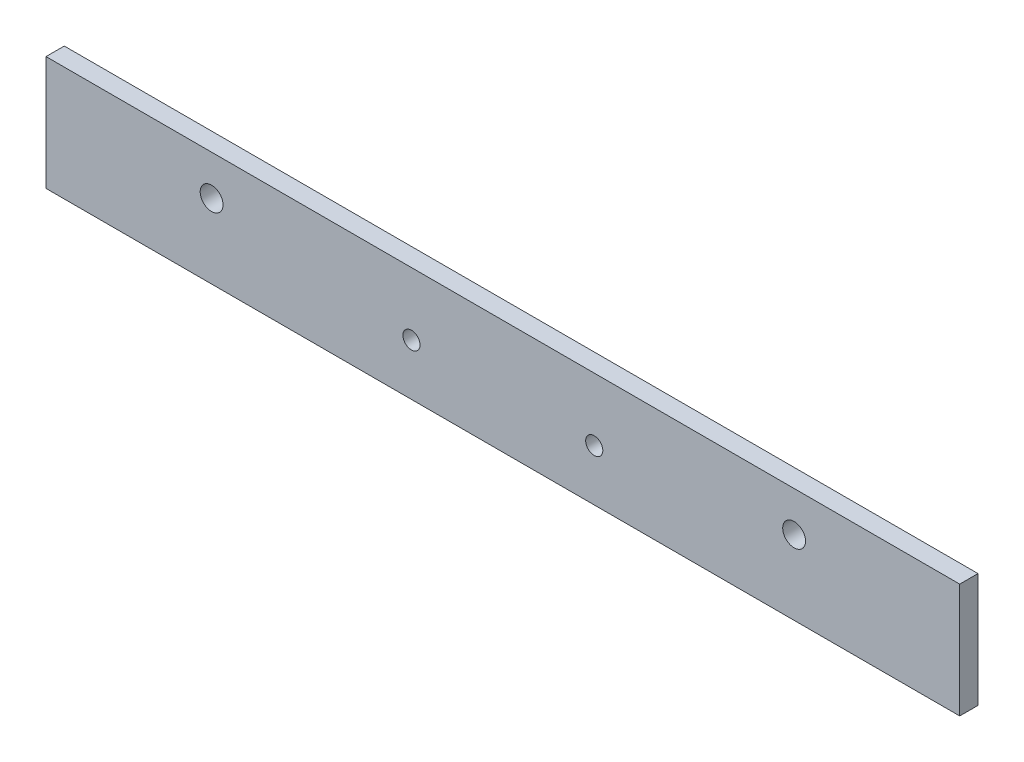
from build123d import *

# Parameters (mm, degrees)
SKETCH2_W               = 160
SKETCH2_H               = 20
BOSS_EXTRUDE1_DEPTH     = 3.2
CUT_EXTRUDE1_DEPTH      = 162.276904732
CUT_EXTRUDE1_DEPTH_BACK = 162.276904732
SKETCH5_R               = 2
SKETCH6_R               = 1.5
CUT_EXTRUDE2_DEPTH      = 10


with BuildPart() as part:
    # Sketch2 → Boss-Extrude1 (new body)
    with BuildSketch(Plane(origin=(0, -10, 10), x_dir=(1, 0, 0), z_dir=(0, 0, -1))):
        with Locations((80, 0)):
            Rectangle(SKETCH2_W, SKETCH2_H)
    extrude(amount=BOSS_EXTRUDE1_DEPTH)

    # Sketch5 → Cut-Extrude1 (cut, two sides: drawn at the far end of the back side and taken through both)
    with BuildSketch(Plane.XY.offset(10).offset(-CUT_EXTRUDE1_DEPTH_BACK)):
        with Locations((131, -7)):
            Circle(SKETCH5_R)
        with Locations((29, -7)):
            Circle(SKETCH5_R)
    extrude(amount=CUT_EXTRUDE1_DEPTH + CUT_EXTRUDE1_DEPTH_BACK, mode=Mode.SUBTRACT)

    # Sketch6 → Cut-Extrude2 (cut)
    with BuildSketch(Plane.XY.offset(10)):
        with Locations((64, -11)):
            Circle(SKETCH6_R)
        with Locations((96, -11)):
            Circle(SKETCH6_R)
    extrude(amount=-CUT_EXTRUDE2_DEPTH, mode=Mode.SUBTRACT)


solid = part.part
